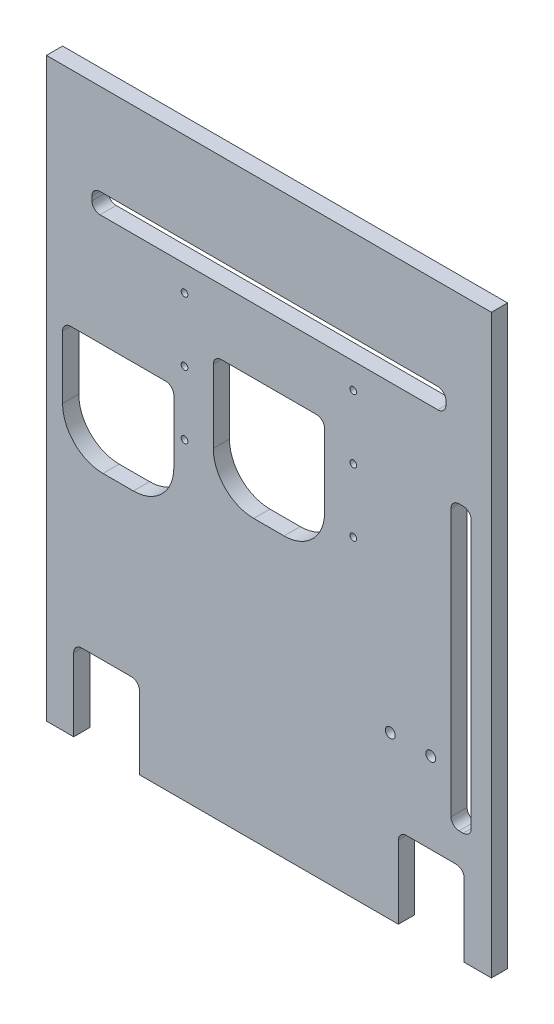
from build123d import *

# Parameters (mm, degrees)
ESQUISSE1_W                  = 220
ESQUISSE1_H                  = 285
BOSS_EXTRU_1_DEPTH           = 8
ESQUISSE2_R                  = 2
ENL_V_MAT_EXTRU_1_DEPTH      = 10
ENL_V_MAT_EXTRU_2_DEPTH      = 361.123589897
ENL_V_MAT_EXTRU_2_DEPTH_BACK = 361.123589897
ESQUISSE3_W                  = 55
ESQUISSE3_H                  = 60
ESQUISSE3_H_2                = 55
ESQUISSE3_W_2                = 10
ESQUISSE3_H_3                = 140
ENL_V_MAT_EXTRU_3_DEPTH      = 361.123589897
ENL_V_MAT_EXTRU_3_DEPTH_BACK = 361.123589897
ESQUISSE5_W                  = 175
ESQUISSE5_H                  = 10
ENL_V_MAT_EXTRU_4_DEPTH      = 361.123589897
ENL_V_MAT_EXTRU_4_DEPTH_BACK = 361.123589897
ESQUISSE6_R                  = 2.45
ENL_V_MAT_EXTRU_5_DEPTH      = 361.123589897
ENL_V_MAT_EXTRU_5_DEPTH_BACK = 361.123589897
ESQUISSE7_R                  = 1.65
ENL_V_MAT_EXTRU_6_DEPTH      = 361.123589897
ENL_V_MAT_EXTRU_6_DEPTH_BACK = 361.123589897
ESQUISSE8_W                  = 32.5
ESQUISSE8_H                  = 40
CONG_1_R                     = 20
CONG_2_R                     = 4


with BuildPart() as part:
    # Esquisse1 → Boss.-Extru.1 (new body)
    with BuildSketch(Plane.XY):
        with Locations((110, 142.5)):
            Rectangle(ESQUISSE1_W, ESQUISSE1_H)
    extrude(amount=BOSS_EXTRU_1_DEPTH)

    # Esquisse2 → Enlèv. mat.-Extru.1 (cut)
    with BuildSketch(Plane.XZ):
        with Locations((110, 4)):
            Circle(ESQUISSE2_R)
        with Locations((213, 4)):
            Circle(ESQUISSE2_R)
        with Locations((7, 4)):
            Circle(ESQUISSE2_R)
    extrude(amount=-ENL_V_MAT_EXTRU_1_DEPTH, mode=Mode.SUBTRACT)

    # Esquisse3 → Enlèv. mat.-Extru.2 (cut, two sides: drawn at the far end of the back side and taken through both)
    with BuildSketch(Plane.XY.offset(8).offset(-ENL_V_MAT_EXTRU_2_DEPTH_BACK)):
        with Locations((110, 168)):
            Rectangle(ESQUISSE3_W, ESQUISSE3_H)
        with Locations((35.5, 147.5)):
            Rectangle(ESQUISSE3_W, ESQUISSE3_H_2)
        with Locations((205, 125)):
            Rectangle(ESQUISSE3_W_2, ESQUISSE3_H_3)
    extrude(amount=ENL_V_MAT_EXTRU_2_DEPTH + ENL_V_MAT_EXTRU_2_DEPTH_BACK, mode=Mode.SUBTRACT)

    # Esquisse5 → Enlèv. mat.-Extru.3 (cut, two sides: drawn at the far end of the back side and taken through both)
    with BuildSketch(Plane.XY.offset(8).offset(-ENL_V_MAT_EXTRU_3_DEPTH_BACK)):
        with Locations((110, 235)):
            Rectangle(ESQUISSE5_W, ESQUISSE5_H)
    extrude(amount=ENL_V_MAT_EXTRU_3_DEPTH + ENL_V_MAT_EXTRU_3_DEPTH_BACK, mode=Mode.SUBTRACT)

    # Esquisse6 → Enlèv. mat.-Extru.4 (cut, two sides: drawn at the far end of the back side and taken through both)
    with BuildSketch(Plane.XY.offset(8).offset(-ENL_V_MAT_EXTRU_4_DEPTH_BACK)):
        with Locations((190, 80)):
            Circle(ESQUISSE6_R)
        with Locations((170, 80)):
            Circle(ESQUISSE6_R)
    extrude(amount=ENL_V_MAT_EXTRU_4_DEPTH + ENL_V_MAT_EXTRU_4_DEPTH_BACK, mode=Mode.SUBTRACT)

    # Esquisse7 → Enlèv. mat.-Extru.5 (cut, two sides: drawn at the far end of the back side and taken through both)
    with BuildSketch(Plane.XY.offset(8).offset(-ENL_V_MAT_EXTRU_5_DEPTH_BACK)):
        with Locations((68.285, 217.4)):
            Circle(ESQUISSE7_R)
        with Locations((68.285, 186)):
            Circle(ESQUISSE7_R)
        with Locations((68.285, 154.6)):
            Circle(ESQUISSE7_R)
        with Locations((151.715, 154.6)):
            Circle(ESQUISSE7_R)
        with Locations((151.715, 186)):
            Circle(ESQUISSE7_R)
        with Locations((151.715, 217.4)):
            Circle(ESQUISSE7_R)
    extrude(amount=ENL_V_MAT_EXTRU_5_DEPTH + ENL_V_MAT_EXTRU_5_DEPTH_BACK, mode=Mode.SUBTRACT)

    # Esquisse8 → Enlèv. mat.-Extru.6 (cut, two sides: drawn at the far end of the back side and taken through both)
    with BuildSketch(Plane.XY.offset(8).offset(-ENL_V_MAT_EXTRU_6_DEPTH_BACK)):
        with Locations((190.25, 20)):
            Rectangle(ESQUISSE8_W, ESQUISSE8_H)
        with Locations((29.75, 20)):
            Rectangle(ESQUISSE8_W, ESQUISSE8_H)
    extrude(amount=ENL_V_MAT_EXTRU_6_DEPTH + ENL_V_MAT_EXTRU_6_DEPTH_BACK, mode=Mode.SUBTRACT)

    # Congé1
    cong_1_edges = [part.edges().sort_by_distance(p)[0] for p in [
        (137.5, 138, 4),
        (82.5, 138, 4),
        (63, 120, 4),
        (8, 120, 4),
    ]]
    fillet(cong_1_edges, radius=CONG_1_R)

    # Congé2
    cong_2_edges = [part.edges().sort_by_distance(p)[0] for p in [
        (137.5, 198, 4),
        (82.5, 198, 4),
        (197.5, 230, 4),
        (197.5, 240, 4),
        (22.5, 240, 4),
        (22.5, 230, 4),
        (63, 175, 4),
        (8, 175, 4),
        (200, 195, 4),
        (210, 195, 4),
        (210, 55, 4),
        (200, 55, 4),
        (206.5, 40, 4),
        (174, 40, 4),
        (46, 40, 4),
        (13.5, 40, 4),
    ]]
    fillet(cong_2_edges, radius=CONG_2_R)


solid = part.part
